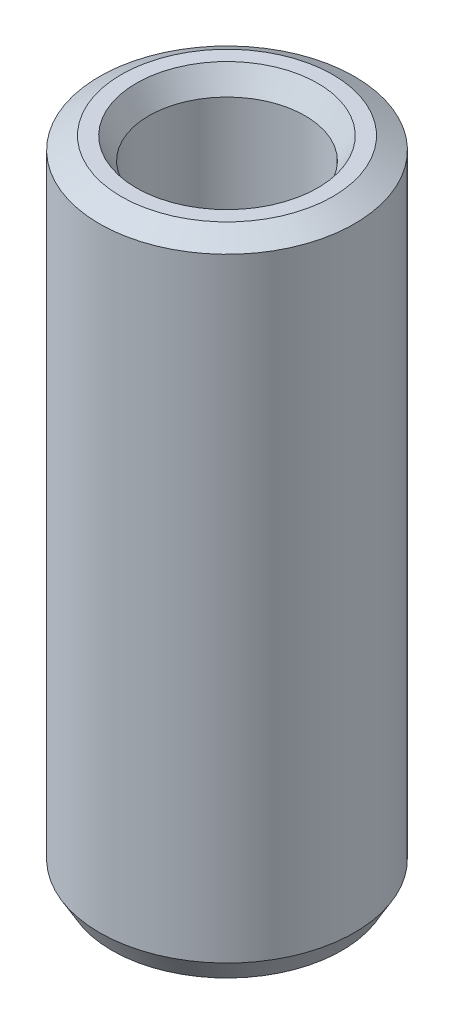
from build123d import *
from OCP.BRepFilletAPI import BRepFilletAPI_MakeChamfer

# Parameters (mm, degrees)
SKETCH1_R           = 27.5
BOSS_EXTRUDE1_DEPTH = 139.735595584
SKETCH2_R           = 16.838102386
CUT_EXTRUDE1_DEPTH  = 146.046670672
CHAMFER1_SIZE       = 2.717087558
CHAMFER1_SIZE2      = 4.706133699


with BuildPart() as part:
    # Sketch1 → Boss-Extrude1 (new body)
    with BuildSketch(Plane(origin=(0, 0, 0), x_dir=(1, 0, 0), z_dir=(0, 1, 0))):
        Circle(SKETCH1_R)
    extrude(amount=BOSS_EXTRUDE1_DEPTH)

    # Sketch2 → Cut-Extrude1 (cut, through all)
    with BuildSketch(Plane(origin=(0, 0, 0), x_dir=(1, 0, 0), z_dir=(0, 1, 0))):
        Circle(SKETCH2_R)
    extrude(amount=CUT_EXTRUDE1_DEPTH, mode=Mode.SUBTRACT)

    # Chamfer1: one chamfer whose edges measure the first distance from different faces: ONE call of the kernel's chamfer builder (chamfer() names one face for all edges)
    chamfer1_edges_1 = [part.edges().sort_by_distance(p)[0] for p in [
        (-16.838102386, 139.735595584, 0),
    ]]
    chamfer1_side_1 = [part.faces().sort_by_distance(p)[0] for p in [
        (-26.722182541, 139.735595584, 0),
    ]]
    chamfer1_edges_2 = [part.edges().sort_by_distance(p)[0] for p in [
        (-16.838102386, 0, 0),
    ]]
    chamfer1_side_2 = [part.faces().sort_by_distance(p)[0] for p in [
        (-16.838102386, 69.867797792, 0),
    ]]
    chamfer1_edges_3 = [part.edges().sort_by_distance(p)[0] for p in [
        (-27.5, 0, 0),
    ]]
    chamfer1_side_3 = [part.faces().sort_by_distance(p)[0] for p in [
        (-26.722182541, 0, 0),
    ]]
    chamfer1_edges_4 = [part.edges().sort_by_distance(p)[0] for p in [
        (-27.5, 139.735595584, 0),
    ]]
    chamfer1_side_4 = [part.faces().sort_by_distance(p)[0] for p in [
        (-27.5, 69.867797792, 0),
    ]]
    chamfer1 = BRepFilletAPI_MakeChamfer(part.part.solid().wrapped)
    for e in chamfer1_edges_1:
        chamfer1.Add(CHAMFER1_SIZE, CHAMFER1_SIZE2, e.wrapped, chamfer1_side_1[0].wrapped)  # the first distance lies on this face
    for e in chamfer1_edges_2:
        chamfer1.Add(CHAMFER1_SIZE, CHAMFER1_SIZE2, e.wrapped, chamfer1_side_2[0].wrapped)  # the first distance lies on this face
    for e in chamfer1_edges_3:
        chamfer1.Add(CHAMFER1_SIZE, CHAMFER1_SIZE2, e.wrapped, chamfer1_side_3[0].wrapped)  # the first distance lies on this face
    for e in chamfer1_edges_4:
        chamfer1.Add(CHAMFER1_SIZE, CHAMFER1_SIZE2, e.wrapped, chamfer1_side_4[0].wrapped)  # the first distance lies on this face
    add(Compound.cast(chamfer1.Shape()), mode=Mode.REPLACE)


solid = part.part
